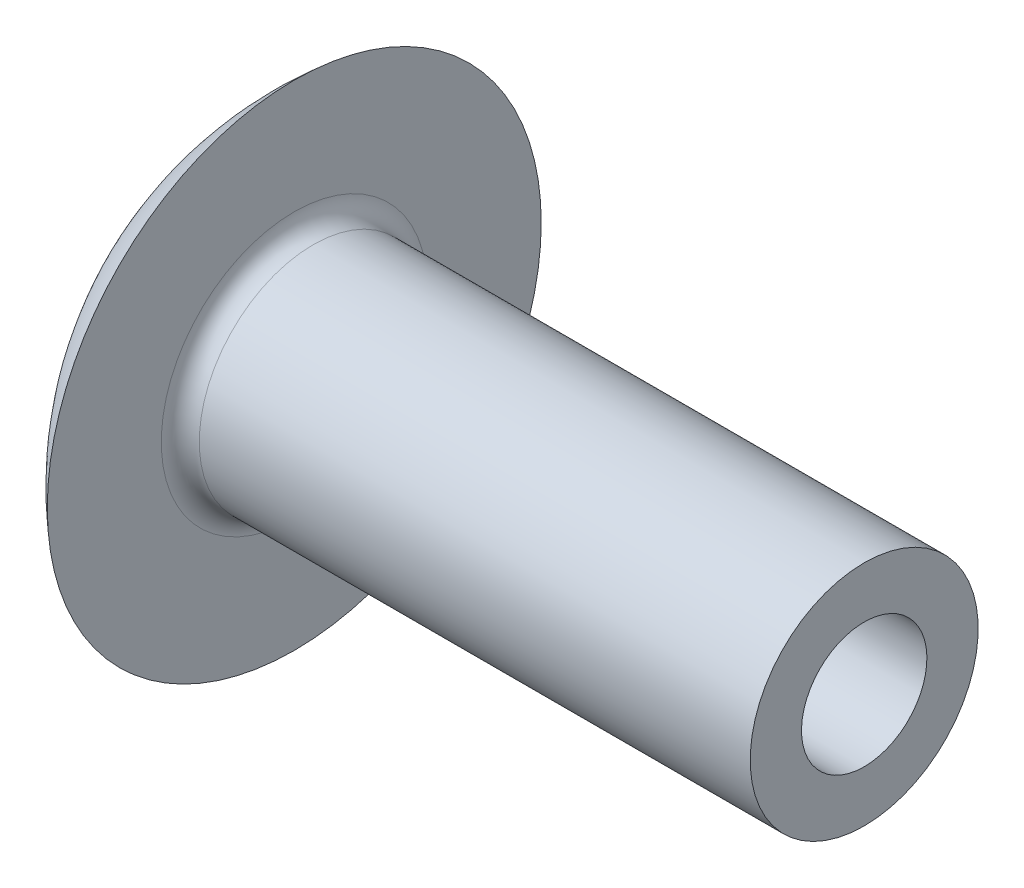
from build123d import *

# Parameters (mm, degrees)
FILLET1_R = 0.1


with BuildPart() as part:
    # Sketch1 → Base-Revolve (revolve)
    with BuildSketch(Plane(origin=(4.242304147, 2.942304147, 0), x_dir=(0, 1, 0), z_dir=(0, 0, 1))):
        with BuildLine():
            Line((-2.612304147, 0.642304147), (-2.342304147, 0.642304147))
            Line((-2.342304147, 0.642304147), (-2.342304147, 3.642304147))
            Line((-2.342304147, 3.642304147), (-1.642304147, 3.642304147))
            ThreePointArc((-1.642304147, 3.642304147), (-2.226413094, 4.085068096), (-2.942304147, 4.242304147))
            Line((-2.942304147, 4.242304147), (-2.942304147, 2.272829736))
            Line((-2.942304147, 2.272829736), (-2.612304147, 2.082304147))
            Line((-2.612304147, 2.082304147), (-2.612304147, 0.642304147))
        make_face()
    revolve(axis=Axis((-6.858184378, 0, 0), (1, 0, 0)))

    # Fillet1
    fillet1_edges = [part.edges().sort_by_distance(p)[0] for p in [
        (0.6, -0.6, 0),
    ]]
    fillet(fillet1_edges, radius=FILLET1_R)


solid = part.part
